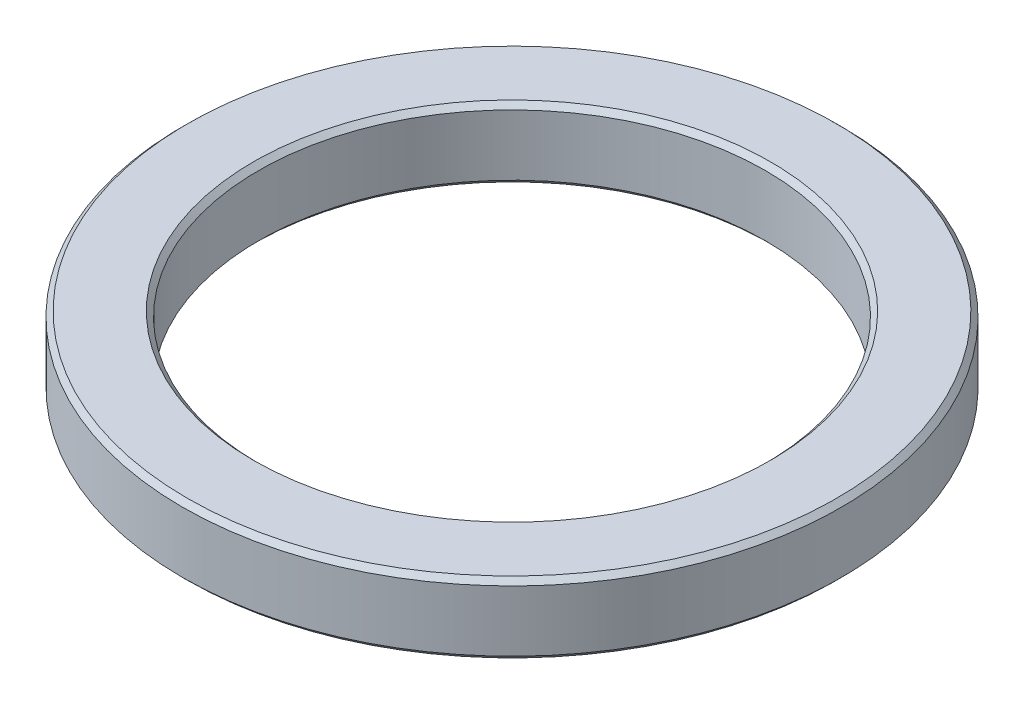
from build123d import *

# Parameters (mm, degrees)
SKETCH_1_R      = 32.5
SKETCH_1_R_2    = 25
EXTRUDE_1_DEPTH = 7
CHAMFER_1_SIZE  = 0.5


with BuildPart() as part:
    # 草图1 → 凸台-拉伸1 (new body)
    with BuildSketch(Plane(origin=(0, 0, 0), x_dir=(1, 0, 0), z_dir=(0, 1, 0))):
        Circle(SKETCH_1_R)
        Circle(SKETCH_1_R_2, mode=Mode.SUBTRACT)
    extrude(amount=EXTRUDE_1_DEPTH)

    # 倒角1
    chamfer_1_edges = [part.edges().sort_by_distance(p)[0] for p in [
        (-25, 0, 0),
        (-32.5, 0, 0),
        (-25, 7, 0),
        (-32.5, 7, 0),
    ]]
    chamfer(chamfer_1_edges, length=CHAMFER_1_SIZE)


solid = part.part
